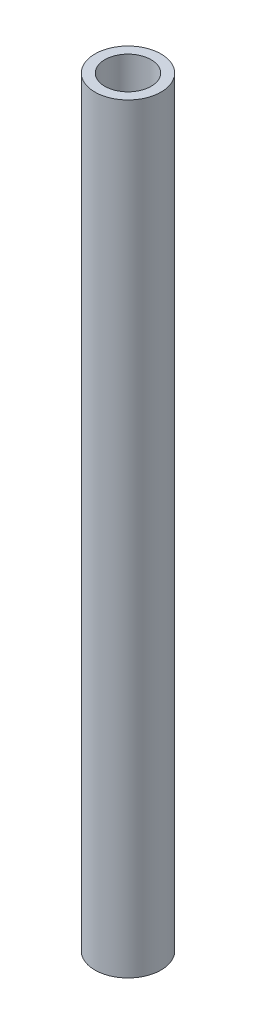
from build123d import *

# Parameters (mm, degrees)
SKETCH1_R           = 6.35
BOSS_EXTRUDE1_DEPTH = 146.05
SKETCH2_R           = 4.445
CUT_EXTRUDE1_DEPTH  = 146.05


with BuildPart() as part:
    # Sketch1 → Boss-Extrude1 (new body)
    with BuildSketch(Plane(origin=(0, 0, 0), x_dir=(1, 0, 0), z_dir=(0, 1, 0))):
        Circle(SKETCH1_R)
    extrude(amount=BOSS_EXTRUDE1_DEPTH)

    # Sketch2 → Cut-Extrude1 (cut)
    with BuildSketch(Plane(origin=(0, 146.05, 0), x_dir=(1, 0, 0), z_dir=(0, 1, 0))):
        Circle(SKETCH2_R)
    extrude(amount=-CUT_EXTRUDE1_DEPTH, mode=Mode.SUBTRACT)


solid = part.part
